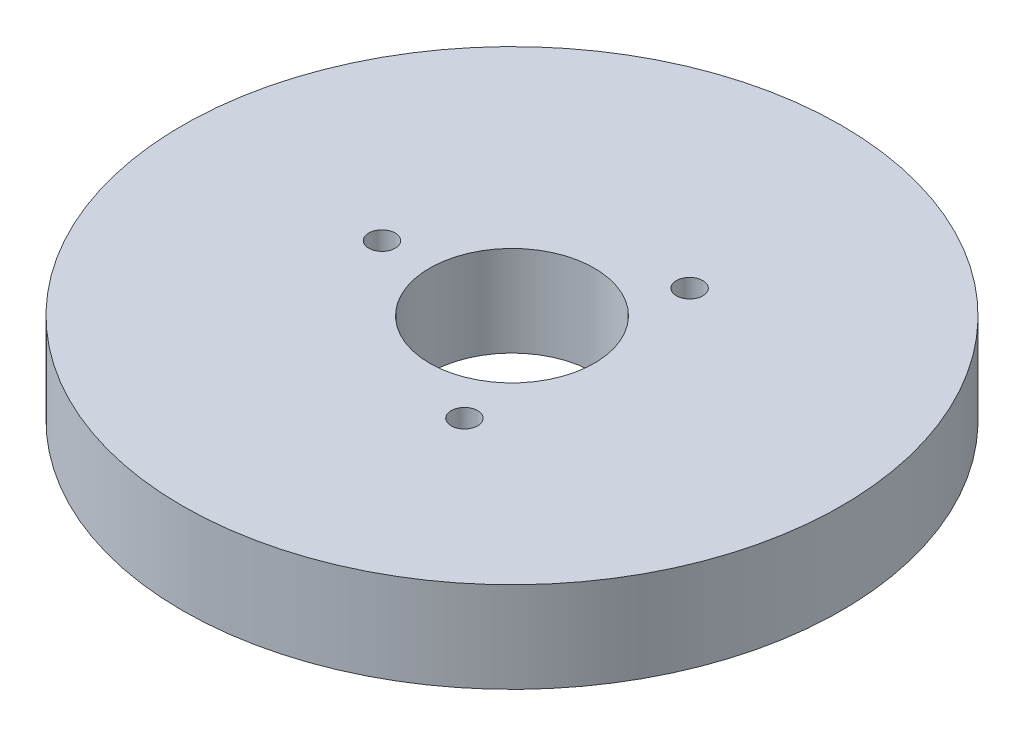
from build123d import *

# Parameters (mm, degrees)
SKETCH1_R           = 40
BOSS_EXTRUDE1_DEPTH = 11
SKETCH2_R           = 10
CUT_EXTRUDE1_DEPTH  = 58.628118137
SKETCH3_R           = 1.604769324
CUT_EXTRUDE2_DEPTH  = 8.614473153
CIRPATTERN1_COUNT   = 3


with BuildPart() as part:
    # Sketch1 → Boss-Extrude1 (new body)
    with BuildSketch(Plane(origin=(0, 0, 0), x_dir=(1, 0, 0), z_dir=(0, 1, 0))):
        Circle(SKETCH1_R)
    extrude(amount=BOSS_EXTRUDE1_DEPTH)

    # Sketch2 → Cut-Extrude1 (cut, through all)
    with BuildSketch(Plane(origin=(0, 0, 0), x_dir=(1, 0, 0), z_dir=(0, 1, 0))):
        Circle(SKETCH2_R)
    extrude(amount=CUT_EXTRUDE1_DEPTH, mode=Mode.SUBTRACT)

    # Sketch3 → Cut-Extrude2 (cut)
    with BuildSketch(Plane(origin=(0, 11, 0), x_dir=(1, 0, 0), z_dir=(0, 1, 0))):
        with Locations((-15.780868658, 0)):
            Circle(SKETCH3_R)
    cut_extrude2 = extrude(amount=-CUT_EXTRUDE2_DEPTH, mode=Mode.SUBTRACT)

    # CirPattern1: Cut-Extrude2 ×3 about axis
    cirpattern1_axis = Axis((0, 0, 0), (0, 1, 0))
    for i in range(1, CIRPATTERN1_COUNT):
        add(cut_extrude2.rotate(cirpattern1_axis, i * 360 / CIRPATTERN1_COUNT), mode=Mode.SUBTRACT)


solid = part.part
